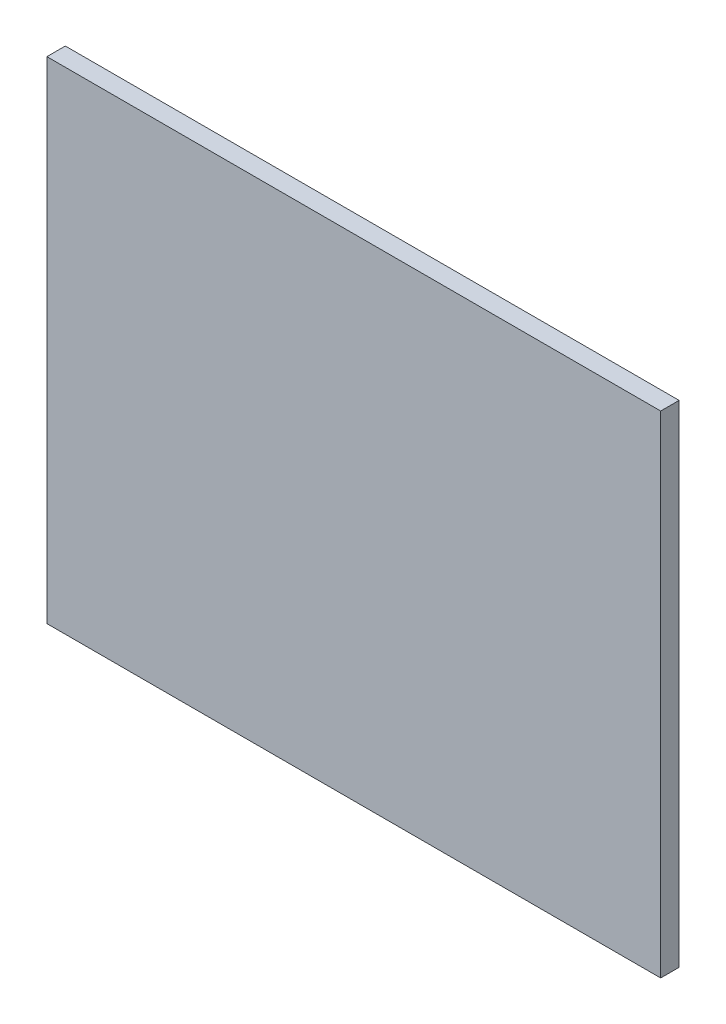
from build123d import *

# Parameters (mm, degrees)
SKICA1_W                = 100
SKICA1_H                = 80
P_IDAT_VYSUNUT_M1_DEPTH = 3


with BuildPart() as part:
    # Skica1 → Přidat vysunutím1 (new body)
    with BuildSketch(Plane.XY):
        with Locations((50, 40)):
            Rectangle(SKICA1_W, SKICA1_H)
    extrude(amount=P_IDAT_VYSUNUT_M1_DEPTH)


solid = part.part
